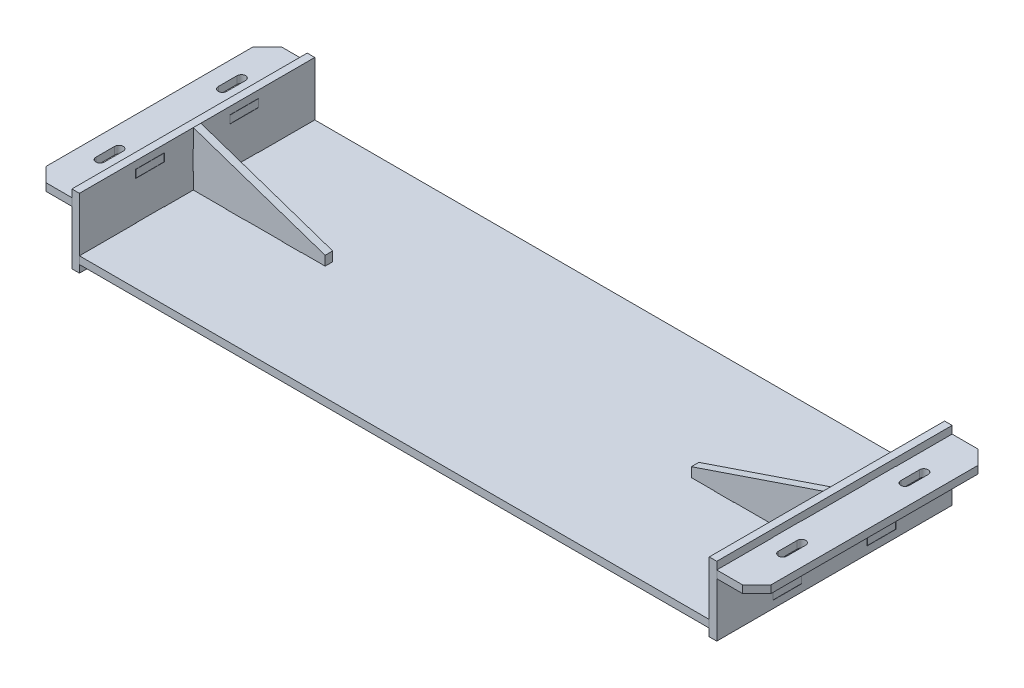
from build123d import *

# Parameters (mm, degrees)
SKETCH1_W           = 685
SKETCH1_H           = 250
BASE_FLANGE1_DEPTH  = 8
SKETCH6_W           = 60
SKETCH6_H           = 8
SKETCH6_W_2         = 70
EXTRUDE1_DEPTH      = 8
SKETCH7_W           = 250
SKETCH7_H           = 73.5
BASE_FLANGE2_DEPTH  = 8
SKETCH12_W          = 30.5
SKETCH12_H          = 8.5
EXTRUDE2_DEPTH      = 699.681794525
SKETCH14_W          = 250
SKETCH14_H          = 8
BASE_FLANGE3_DEPTH  = 50.5
SKETCH19_W          = 60
SKETCH19_H          = 8
SKETCH19_W_2        = 70
EXTRUDE3_DEPTH      = 8
BREAK_CORNER1_START = 41.5
BREAK_CORNER1_DEPTH = 8
EXTRUDE4_DEPTH      = 8
BASE_FLANGE4_DEPTH  = 8
SKETCH38_W          = 8.5
SKETCH38_H          = 20.5
EXTRUDE5_DEPTH      = 10
SKETCH39_W          = 20.5
SKETCH39_H          = 8.5
EXTRUDE6_DEPTH      = 10


# Read off the part's stored shape, not the designer's step: Break-Corner1
# Sheet-metal steps are written as plain solids
with BuildPart() as part:
    # Sketch1 → Base-Flange1 (new body)
    with BuildSketch(Plane(origin=(0, 0, 0), x_dir=(1, 0, 0), z_dir=(0, 1, 0))):
        Rectangle(SKETCH1_W, SKETCH1_H)
    extrude(amount=-BASE_FLANGE1_DEPTH)

    # Sketch6 → Extrude1 (cut)
    with BuildSketch(Plane(origin=(342.5, 0, 0), x_dir=(0, 0, -1), z_dir=(1, 0, 0))):
        with Locations((-95, -4)):
            Rectangle(SKETCH6_W, SKETCH6_H)
        with Locations((95, -4)):
            Rectangle(SKETCH6_W, SKETCH6_H)
        with Locations((0, -4)):
            Rectangle(SKETCH6_W_2, SKETCH6_H)
    extrude1 = extrude(amount=-EXTRUDE1_DEPTH, mode=Mode.SUBTRACT)

    # Mirror1: Extrude1 across plane
    add(extrude1.mirror(Plane(origin=(0, 0, 0), x_dir=(0, 0, 1), z_dir=(1, 0, 0))), mode=Mode.SUBTRACT)

    # Sketch39 → Extrude6 (cut)
    with BuildSketch(Plane.XZ.offset(8)):
        with Locations((289.5, 0)):
            Rectangle(SKETCH39_W, SKETCH39_H)
        with Locations((229.5, 0)):
            Rectangle(SKETCH39_W, SKETCH39_H)
        with Locations((-289.5, 0)):
            Rectangle(SKETCH39_W, SKETCH39_H)
        with Locations((-229.5, 0)):
            Rectangle(SKETCH39_W, SKETCH39_H)
    extrude(amount=-EXTRUDE6_DEPTH, mode=Mode.SUBTRACT)


with BuildPart() as body_2:
    # Sketch7 → Base-Flange2 (new body)
    with BuildSketch(Plane(origin=(334.5, 0, 0), x_dir=(0, 0, -1), z_dir=(1, 0, 0))):
        with Locations((0, 20.75)):
            Rectangle(SKETCH7_W, SKETCH7_H)
    extrude(amount=BASE_FLANGE2_DEPTH)

    # Sketch12 → Extrude2 (cut, through all)
    with BuildSketch(Plane(origin=(342.5, 0, 0), x_dir=(0, 0, -1), z_dir=(1, 0, 0))):
        with Locations((-50, -4)):
            Rectangle(SKETCH12_W, SKETCH12_H)
        with Locations((50, -4)):
            Rectangle(SKETCH12_W, SKETCH12_H)
        with Locations((50, 45.5)):
            Rectangle(SKETCH12_W, SKETCH12_H)
        with Locations((-50, 45.5)):
            Rectangle(SKETCH12_W, SKETCH12_H)
    extrude(amount=-EXTRUDE2_DEPTH, mode=Mode.SUBTRACT)

    # Sketch38 → Extrude5 (cut)
    with BuildSketch(Plane(origin=(342.5, 0, 0), x_dir=(0, 0, -1), z_dir=(1, 0, 0))):
        with Locations((0, 27.5)):
            Rectangle(SKETCH38_W, SKETCH38_H)
    extrude(amount=-EXTRUDE5_DEPTH, mode=Mode.SUBTRACT)


with BuildPart() as body_3:
    # Sketch14 → Base-Flange3 (new body)
    with BuildSketch(Plane.ZY.offset(-334.5)):
        with Locations((0, 45.5)):
            Rectangle(SKETCH14_W, SKETCH14_H)
    extrude(amount=-BASE_FLANGE3_DEPTH)

    # Sketch19 → Extrude3 (cut)
    with BuildSketch(Plane(origin=(342.5, 0, 0), x_dir=(0, 0, -1), z_dir=(1, 0, 0))):
        with Locations((95, 45.5)):
            Rectangle(SKETCH19_W, SKETCH19_H)
        with Locations((0, 45.5)):
            Rectangle(SKETCH19_W_2, SKETCH19_H)
        with Locations((-95, 45.5)):
            Rectangle(SKETCH19_W, SKETCH19_H)
    extrude(amount=-EXTRUDE3_DEPTH, mode=Mode.SUBTRACT)

    # Break-Corner1 outline → Break-Corner1 (cut)
    with BuildSketch(Plane(origin=(0, 0, 0), x_dir=(1, 0, 0), z_dir=(0, 1, 0)).offset(BREAK_CORNER1_START)):
        Polygon((385, -125), (385, -110), (370, -125), align=None)
        Polygon((370, 125), (385, 110), (385, 125), align=None)
    extrude(amount=BREAK_CORNER1_DEPTH, mode=Mode.SUBTRACT)

    # Sketch20 → Extrude4 (cut)
    with BuildSketch(Plane(origin=(0, 49.5, 0), x_dir=(1, 0, 0), z_dir=(0, 1, 0))):
        with BuildLine():
            Line((367, 75), (367, 55))
            ThreePointArc((367, 55), (362.5, 50.5), (358, 55))
            Line((358, 55), (358, 75))
            ThreePointArc((358, 75), (362.5, 79.5), (367, 75))
        make_face()
        with BuildLine():
            Line((367, -75), (367, -55))
            ThreePointArc((367, -55), (362.5, -50.5), (358, -55))
            Line((358, -55), (358, -75))
            ThreePointArc((358, -75), (362.5, -79.5), (367, -75))
        make_face()
    extrude(amount=-EXTRUDE4_DEPTH, mode=Mode.SUBTRACT)


with BuildPart() as body_4:
    # Mirror4: mirrored copy
    add(body_3.part.mirror(Plane(origin=(0, 0, 0), x_dir=(0, 0, 1), z_dir=(1, 0, 0))))


with BuildPart() as body_5:
    # Sketch29 → Base-Flange4 (new body)
    with BuildSketch(Plane.XY.offset(4)):
        Polygon((219.5, 0), (219.5, -8), (239.5, -8), (239.5, 0), (279.5, 0), (279.5, -8), (299.5, -8), (299.5, 0), (334.5, 0), (334.5, 17.5), (342.5, 17.5), (342.5, 37.5), (334.5, 37.5), (334.5, 57.5), (194.5, 10), (194.5, 0), align=None)
    extrude(amount=-BASE_FLANGE4_DEPTH)


with BuildPart() as body_6:
    # Mirror5: mirrored copy
    add(body_5.part.mirror(Plane(origin=(0, 0, 0), x_dir=(0, 0, 1), z_dir=(1, 0, 0))))


with BuildPart() as body_7:
    # Mirror3: mirrored copy
    add(body_2.part.mirror(Plane(origin=(0, 0, 0), x_dir=(0, 0, 1), z_dir=(1, 0, 0))))


solid = Compound([part.part, body_2.part, body_3.part, body_4.part, body_5.part, body_6.part, body_7.part])
